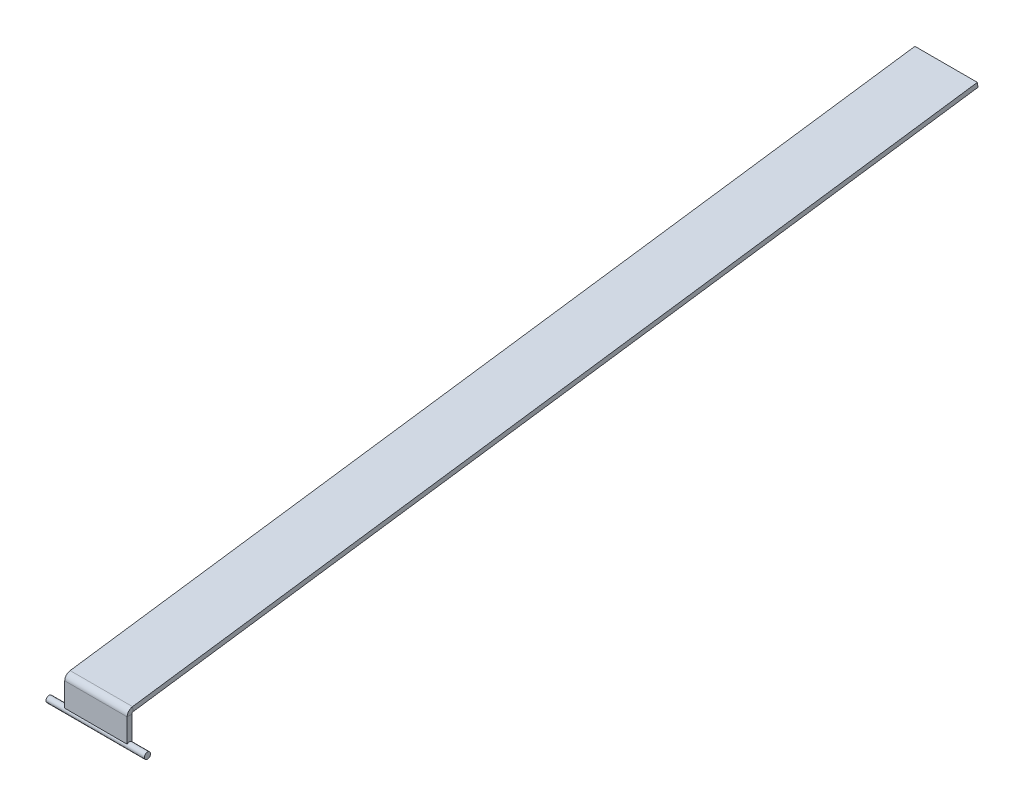
from build123d import *

# Parameters (mm, degrees)
BASE_FLANGE1_DEPTH     = 2
CUT_EXTRUDE1_START     = -2
CUT_EXTRUDE1_OUTLINE_W = 0.3
CUT_EXTRUDE1_OUTLINE_H = 0.067712434
CUT_EXTRUDE1_DEPTH     = 4
SKETCH8_R              = 0.2
BOSS_EXTRUDE1_DEPTH    = 3.15


# Read off the part's stored shape, not the designer's step: Cut-Extrude1
# Sheet-metal steps are written as plain solids
with BuildPart() as part:
    # Sketch1 → Base-Flange1 (new, symmetric)
    with BuildSketch(Plane(origin=(0, 0, 0), x_dir=(0, 0, -1), z_dir=(1, 0, 0))):
        with BuildLine():
            Line((0, 0), (0, 1.852075023))
            ThreePointArc((0, 1.852075023), (0.09819474, 2.114588994), (0.344567924, 2.24821551))
            Line((0.344567924, 2.24821551), (54.469316873, 9.82191048))
            Line((54.469316873, 9.82191048), (54.51089093, 9.524805115))
            Line((54.51089093, 9.524805115), (0.386141981, 1.951110145))
            ThreePointArc((0.386141981, 1.951110145), (0.324548685, 1.917703516), (0.3, 1.852075023))
            Line((0.3, 1.852075023), (0.3, 0))
            Line((0.3, 0), (0, 0))
        make_face()
    extrude(amount=BASE_FLANGE1_DEPTH, both=True)

    # Cut-Extrude1 outline → Cut-Extrude1 (cut)
    with BuildSketch(Plane(origin=(0, 0, 0), x_dir=(0, 0, -1), z_dir=(1, 0, 0)).offset(CUT_EXTRUDE1_START)):
        with Locations((0.15, 0.033856217)):
            Rectangle(CUT_EXTRUDE1_OUTLINE_W, CUT_EXTRUDE1_OUTLINE_H)
    extrude(amount=CUT_EXTRUDE1_DEPTH, mode=Mode.SUBTRACT)

    # Sketch8 → Boss-Extrude1 (add, symmetric)
    with BuildSketch(Plane(origin=(0, 0, 0), x_dir=(0, 0, -1), z_dir=(1, 0, 0))):
        with Locations((0.15, 0.2)):
            Circle(SKETCH8_R)
    extrude(amount=BOSS_EXTRUDE1_DEPTH, both=True)


solid = part.part
